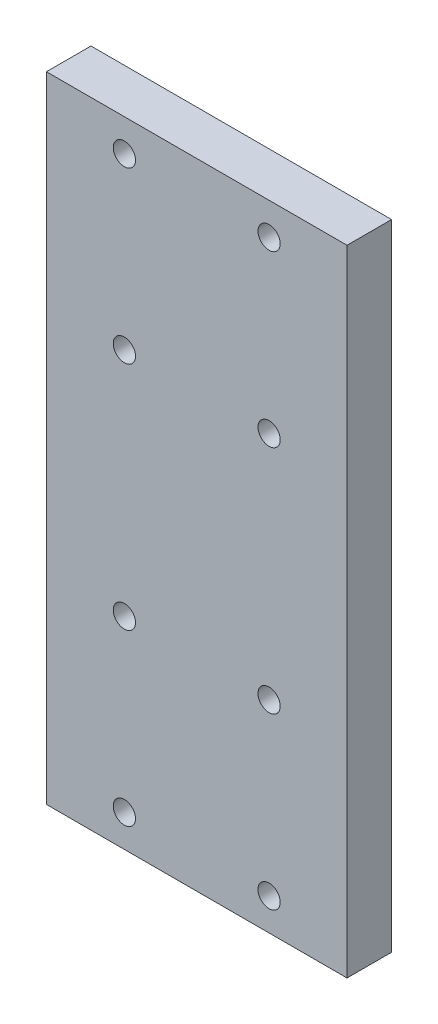
from build123d import *

# Parameters (mm, degrees)
SKETCH1_W           = 54
SKETCH1_H           = 114
SKETCH1_R           = 2
BOSS_EXTRUDE1_DEPTH = 8


with BuildPart() as part:
    # Sketch1 → Boss-Extrude1 (new body)
    with BuildSketch(Plane.XY):
        Rectangle(SKETCH1_W, SKETCH1_H)
        with Locations((-13, 51.22)):
            Circle(SKETCH1_R, mode=Mode.SUBTRACT)
        with Locations((13, 51.22)):
            Circle(SKETCH1_R, mode=Mode.SUBTRACT)
        with Locations((13, 20.72)):
            Circle(SKETCH1_R, mode=Mode.SUBTRACT)
        with Locations((-13, 20.72)):
            Circle(SKETCH1_R, mode=Mode.SUBTRACT)
        with Locations((13, -20.72)):
            Circle(SKETCH1_R, mode=Mode.SUBTRACT)
        with Locations((-13, -20.72)):
            Circle(SKETCH1_R, mode=Mode.SUBTRACT)
        with Locations((-13, -51.22)):
            Circle(SKETCH1_R, mode=Mode.SUBTRACT)
        with Locations((13, -51.22)):
            Circle(SKETCH1_R, mode=Mode.SUBTRACT)
    extrude(amount=BOSS_EXTRUDE1_DEPTH)


solid = part.part
